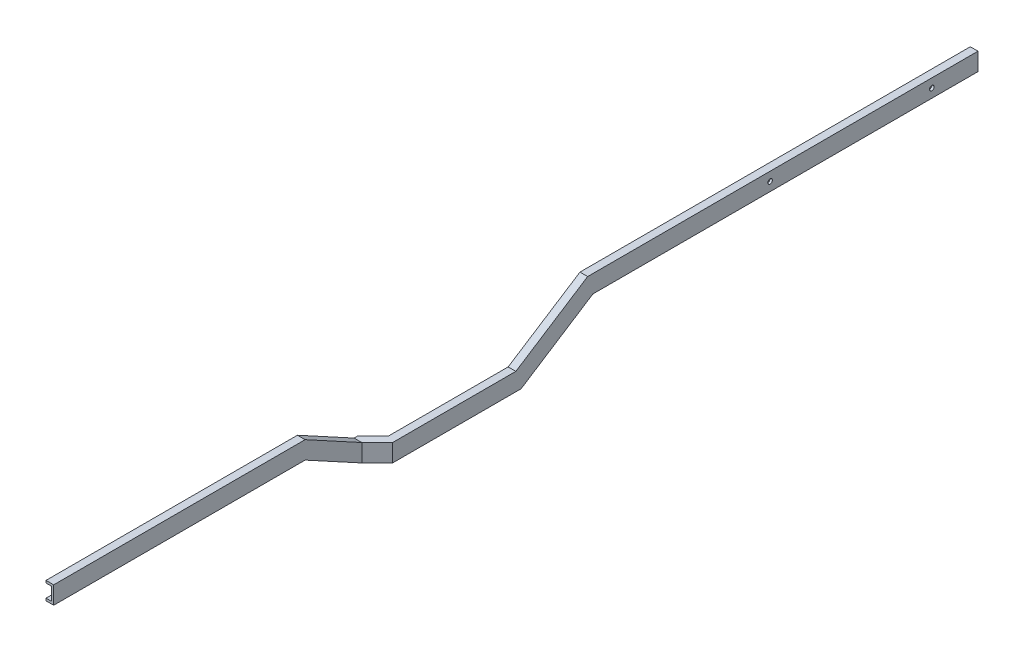
from build123d import *

# Parameters (mm, degrees)
SKETCH_1_W           = 590
SKETCH_1_H           = 11.5
EXTRUDE_1_DEPTH      = 5
SKETCH_2_W           = 590
SKETCH_2_H           = 8.5
CUT_EXTRUDE_1_DEPTH  = 3.5
SKETCH_3_W           = 390
SKETCH_3_H           = 11.5
EXTRUDE_2_DEPTH      = 10
CHAMFER_1_SIZE       = 10
CUT_EXTRUDE_2_DEPTH  = 296.604888322
SKETCH_5_W           = 377.928932188
SKETCH_5_H           = 8.5
CUT_EXTRUDE_3_DEPTH  = 3.5
SKETCH_7_W           = 9.262731361
SKETCH_7_H           = 8.5
CUT_EXTRUDE_5_DEPTH  = 2.5
SKETCH_8_W           = 5
SKETCH_8_H           = 200
EXTRUDE_3_DEPTH      = 20
CUT_EXTRUDE_6_DEPTH  = 297.29050356
CUT_EXTRUDE_7_DEPTH  = 297.29050356
CUT_EXTRUDE_8_DEPTH  = 3.5
SKETCH_12_W          = 5
SKETCH_12_H          = 300
EXTRUDE_4_DEPTH      = 30
CUT_EXTRUDE_9_DEPTH  = 298.536657405
CUT_EXTRUDE_10_DEPTH = 3.5
SKETCH_16_R          = 1.5
CUT_EXTRUDE_11_DEPTH = 298.536657405


with BuildPart() as part:
    # 草图1 → 凸台-拉伸1 (new body)
    with BuildSketch(Plane(origin=(0, 0, 0), x_dir=(0, 0, -1), z_dir=(1, 0, 0))):
        Rectangle(SKETCH_1_W, SKETCH_1_H)
    extrude(amount=EXTRUDE_1_DEPTH)

    # 草图2 → 切除-拉伸1 (cut)
    with BuildSketch(Plane.ZY):
        with Locations((0, -0.131137871)):
            Rectangle(SKETCH_2_W, SKETCH_2_H)
    extrude(amount=-CUT_EXTRUDE_1_DEPTH, mode=Mode.SUBTRACT)

    # 草图3 → 凸台-拉伸2 (add)
    with BuildSketch(Plane(origin=(5, 0, 0), x_dir=(0, 0, -1), z_dir=(1, 0, 0))):
        with Locations((100, 0)):
            Rectangle(SKETCH_3_W, SKETCH_3_H)
    extrude(amount=EXTRUDE_2_DEPTH)

    # 倒角1
    chamfer_1_edges = [part.edges().sort_by_distance(p)[0] for p in [
        (15, 0, 95),
    ]]
    chamfer(chamfer_1_edges, length=CHAMFER_1_SIZE - 0.0001)  # a hair under: the kernel refuses the full size

    # 草图4 → 切除-拉伸2 (cut, through all)
    with BuildSketch(Plane(origin=(0, 5.75, 0), x_dir=(1, 0, 0), z_dir=(0, 1, 0))):
        Polygon((0, -92.928932188), (0, 295), (10, 295), (10, -82.928932188), align=None)
    extrude(amount=-CUT_EXTRUDE_2_DEPTH, mode=Mode.SUBTRACT)

    # 草图5 → 切除-拉伸3 (cut)
    with BuildSketch(Plane.ZY.offset(-10)):
        with Locations((-106.035533906, 0)):
            Rectangle(SKETCH_5_W, SKETCH_5_H)
    extrude(amount=-CUT_EXTRUDE_3_DEPTH, mode=Mode.SUBTRACT)

    # 草图7 → 切除-拉伸5 (cut)
    with BuildSketch(Plane(origin=(46.464466094, 0, 46.464466094), x_dir=(-0.7071067811865471, 0, 0.7071067811865479), z_dir=(-0.7071067811865479, 0, -0.7071067811865471))):
        with Locations((61.079312439, -0.131137871)):
            Rectangle(SKETCH_7_W, SKETCH_7_H)
    extrude(amount=-CUT_EXTRUDE_5_DEPTH, mode=Mode.SUBTRACT)

    # 草图8 → 凸台-拉伸3 (add)
    with BuildSketch(Plane(origin=(0, 5.75, 0), x_dir=(1, 0, 0), z_dir=(0, 1, 0))):
        with Locations((2.5, -195)):
            Rectangle(SKETCH_8_W, SKETCH_8_H)
    extrude(amount=EXTRUDE_3_DEPTH)

    # 草图9 → 切除-拉伸6 (cut, through all)
    with BuildSketch(Plane(origin=(5, 0, 0), x_dir=(0, 0, -1), z_dir=(1, 0, 0))):
        Polygon((-295, 14.25), (-131.790247395, 14.25), (-95, -5.75), (-295, -5.75), align=None)
    extrude(amount=-CUT_EXTRUDE_6_DEPTH, mode=Mode.SUBTRACT)

    # 草图10 → 切除-拉伸7 (cut, through all)
    with BuildSketch(Plane(origin=(5, 0, 0), x_dir=(0, 0, -1), z_dir=(1, 0, 0))):
        Polygon((-95, 5.75), (-131.790247395, 25.75), (-95, 25.75), align=None)
    extrude(amount=-CUT_EXTRUDE_7_DEPTH, mode=Mode.SUBTRACT)

    # 草图11 → 切除-拉伸8 (cut)
    with BuildSketch(Plane.ZY):
        Polygon((132.171609821, 24.25), (95.140132691, 4.118862129), (110.013262981, 4.118862129), (131.408884969, 15.75), (295, 15.75), (295, 24.25), align=None)
    extrude(amount=-CUT_EXTRUDE_8_DEPTH, mode=Mode.SUBTRACT)

    # 草图12 → 凸台-拉伸4 (add)
    with BuildSketch(Plane(origin=(0, 5.75, 0), x_dir=(1, 0, 0), z_dir=(0, 1, 0))):
        with Locations((12.5, 145)):
            Rectangle(SKETCH_12_W, SKETCH_12_H)
    extrude(amount=EXTRUDE_4_DEPTH)

    # 草图13 → 切除-拉伸9 (cut, through all)
    with BuildSketch(Plane(origin=(15, 0, 0), x_dir=(0, 0, -1), z_dir=(1, 0, 0))):
        Polygon((-1.619558014, -5.75), (45, 24.25), (295, 24.25), (295, -5.75), align=None)
        Polygon((-5, 5.75), (41.619558014, 35.75), (-5, 35.75), align=None)
    extrude(amount=-CUT_EXTRUDE_9_DEPTH, mode=Mode.SUBTRACT)

    # 草图15 → 切除-拉伸10 (cut)
    with BuildSketch(Plane.ZY.offset(-10)):
        Polygon((-44.559072784, 25.75), (-295, 25.75), (-295, 34.25), (-42.06048523, 34.25), (4.559072784, 4.25), (-11.148389541, 4.25), align=None)
    extrude(amount=-CUT_EXTRUDE_10_DEPTH, mode=Mode.SUBTRACT)

    # 草图16 → 切除-拉伸11 (cut, through all)
    with BuildSketch(Plane(origin=(15, 0, 0), x_dir=(0, 0, -1), z_dir=(1, 0, 0))):
        with Locations((160, 30)):
            Circle(SKETCH_16_R)
        with Locations((265, 30)):
            Circle(SKETCH_16_R)
    extrude(amount=-CUT_EXTRUDE_11_DEPTH, mode=Mode.SUBTRACT)


solid = part.part
